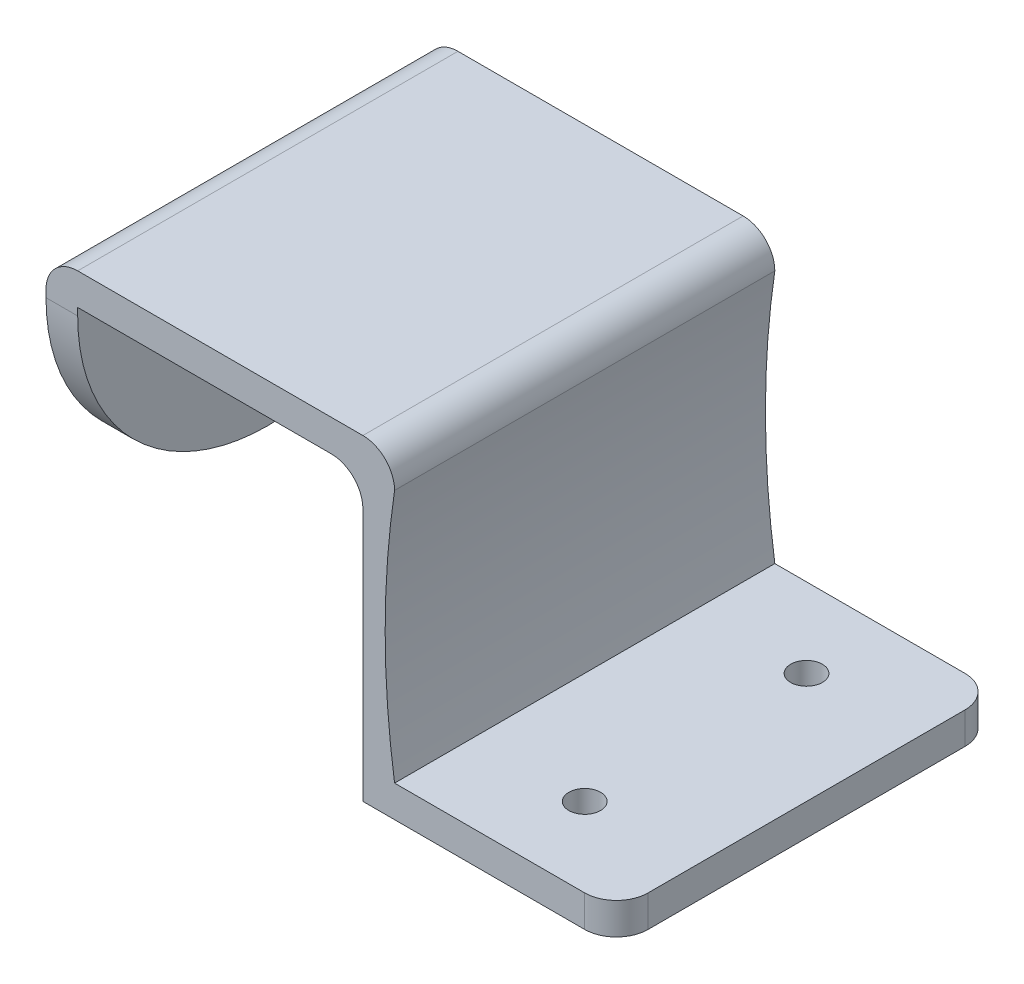
from build123d import *

# Parameters (mm, degrees)
BOSS_EXTRUDE1_DEPTH = 120
BOSS_EXTRUDE2_DEPTH = 10
SKETCH3_R           = 9.25
SKETCH3_R_2         = 1.5
CUT_EXTRUDE1_DEPTH  = 10
FILLET1_R           = 10
SKETCH4_R           = 5
CUT_EXTRUDE2_DEPTH  = 20
FILLET2_R           = 10
FILLET4_R           = 10
FILLET6_R           = 10
SKETCH5_R           = 2.5
CUT_EXTRUDE3_DEPTH  = 5


with BuildPart() as part:
    # Sketch1 → Boss-Extrude1 (new body)
    with BuildSketch(Plane.XY):
        with BuildLine():
            Line((0, 0), (-70, 0))
            ThreePointArc((-70, 0), (-72.966131028, 40), (-70, 80))
            Line((-70, 80), (-70, 90))
            Line((-70, 90), (-170, 90))
            Line((-170, 90), (-170, 80))
            Line((-170, 80), (-80, 80))
            Line((-80, 80), (-80, -10))
            Line((-80, -10), (0, -10))
            Line((0, -10), (0, 0))
        make_face()
    extrude(amount=BOSS_EXTRUDE1_DEPTH)

    # Sketch2 → Boss-Extrude2 (add)
    with BuildSketch(Plane.ZY.offset(170)):
        with BuildLine():
            Line((0, 80), (0, 77.669175799))
            ThreePointArc((0, 77.669175799), (60, 17.669175799), (120, 77.669175799))
            Line((120, 77.669175799), (120, 90))
            Line((120, 90), (0, 90))
            Line((0, 90), (0, 80))
        make_face()
    extrude(amount=BOSS_EXTRUDE2_DEPTH)

    # Sketch3 → Cut-Extrude1 (cut)
    with BuildSketch(Plane.ZY.offset(180)):
        with Locations((60, 53.8345879)):
            Circle(SKETCH3_R)
        with Locations((48, 46.906384669)):
            Circle(SKETCH3_R_2)
        with Locations((60, 67.69099436)):
            Circle(SKETCH3_R_2)
        with Locations((72, 46.906384669)):
            Circle(SKETCH3_R_2)
    extrude(amount=-CUT_EXTRUDE1_DEPTH, mode=Mode.SUBTRACT)

    # Fillet1
    fillet1_edges = [part.edges().sort_by_distance(p)[0] for p in [
        (0, -5, 0),
        (0, -5, 120),
    ]]
    fillet(fillet1_edges, radius=FILLET1_R)

    # Sketch4 → Cut-Extrude2 (cut)
    with BuildSketch(Plane(origin=(0, 0, 0), x_dir=(1, 0, 0), z_dir=(0, 1, 0))):
        with Locations(Location((-35, -25, 0), (0, 0, 180))):
            Circle(SKETCH4_R)
        with Locations(Location((-35, -95, 0), (0, 0, 180))):
            Circle(SKETCH4_R)
    extrude(amount=-CUT_EXTRUDE2_DEPTH, mode=Mode.SUBTRACT)

    # Fillet2
    fillet2_edges = [part.edges().sort_by_distance(p)[0] for p in [
        (-70, 90, 60),
    ]]
    fillet(fillet2_edges, radius=FILLET2_R - 0.0001)  # a hair under: the kernel refuses the full size

    # Fillet4
    fillet4_edges = [part.edges().sort_by_distance(p)[0] for p in [
        (-80, 80, 60),
    ]]
    fillet(fillet4_edges, radius=FILLET4_R)

    # Fillet6
    fillet6_edges = [part.edges().sort_by_distance(p)[0] for p in [
        (-180, 90, 60),
    ]]
    fillet(fillet6_edges, radius=FILLET6_R)

    # Sketch5 → Cut-Extrude3 (cut)
    with BuildSketch(Plane.ZY.offset(180)):
        with Locations((72, 46.906384669)):
            Circle(SKETCH5_R)
        with Locations((60, 67.69099436)):
            Circle(SKETCH5_R)
        with Locations((48, 46.906384669)):
            Circle(SKETCH5_R)
    extrude(amount=-CUT_EXTRUDE3_DEPTH, mode=Mode.SUBTRACT)


solid = part.part
